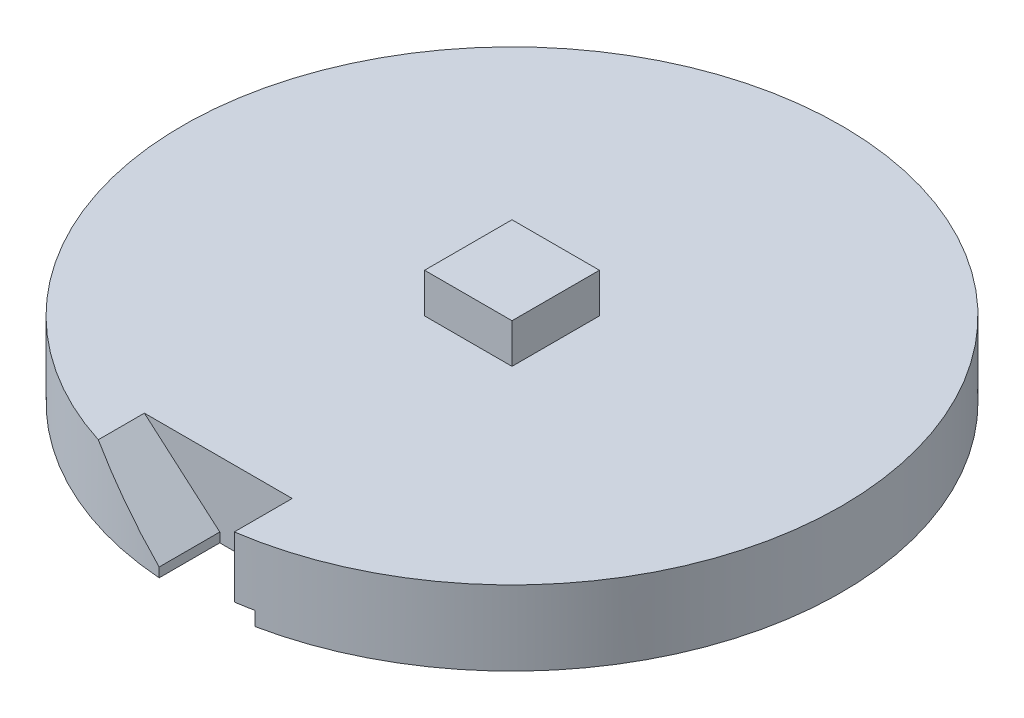
from build123d import *

# Parameters (mm, degrees)
SKETCH1_R           = 37.5
BOSS_EXTRUDE1_DEPTH = 8.5
SKETCH9_W           = 9.95
SKETCH9_H           = 9.95
BOSS_EXTRUDE2_DEPTH = 13
SKETCH2_R           = 5
BOSS_EXTRUDE3_DEPTH = 10
CUT_EXTRUDE5_DEPTH  = 10
CUT_EXTRUDE9_DEPTH  = 7


with BuildPart() as part:
    # Sketch1 → Boss-Extrude1 (new body)
    with BuildSketch(Plane(origin=(0, 0, 0), x_dir=(1, 0, 0), z_dir=(0, 1, 0))):
        Circle(SKETCH1_R)
    extrude(amount=BOSS_EXTRUDE1_DEPTH)

    # Sketch9 → Boss-Extrude2 (add)
    with BuildSketch(Plane(origin=(0, 0, 0), x_dir=(1, 0, 0), z_dir=(0, 1, 0))):
        Rectangle(SKETCH9_W, SKETCH9_H)
    extrude(amount=BOSS_EXTRUDE2_DEPTH)

    # Sketch2 → Boss-Extrude3 (add)
    with BuildSketch(Plane.XZ):
        Circle(SKETCH2_R)
    extrude(amount=BOSS_EXTRUDE3_DEPTH)

    # Sketch11 → Cut-Extrude5 (cut)
    with BuildSketch(Plane.XZ.offset(10)):
        with BuildLine():
            Line((0.018011531, -1.443232403), (0.565734089, -1.443232403))
            ThreePointArc((0.565734089, -1.443232403), (0.018011531, 1.556767597), (-0.529711026, -1.443232403))
            Line((-0.529711026, -1.443232403), (0.018011531, -1.443232403))
        make_face()
    extrude(amount=-CUT_EXTRUDE5_DEPTH, mode=Mode.SUBTRACT)

    # Sketch14 → Cut-Extrude9 (cut)
    with BuildSketch(Plane.XY.offset(37.5)):
        Polygon((-1.479409771, -0.034279728), (5.487832291, -0.034279728), (7.493094394, 0), (7.493094394, 1.595594951), (5.487832291, 1.595594951), (5.487832291, 5.965720272), (5.487832291, 8.5), (-11.335299807, 8.5), (-2.75755208, 1.072472069), (-2.75755208, 0), align=None)
    extrude(amount=-CUT_EXTRUDE9_DEPTH, mode=Mode.SUBTRACT)


solid = part.part
